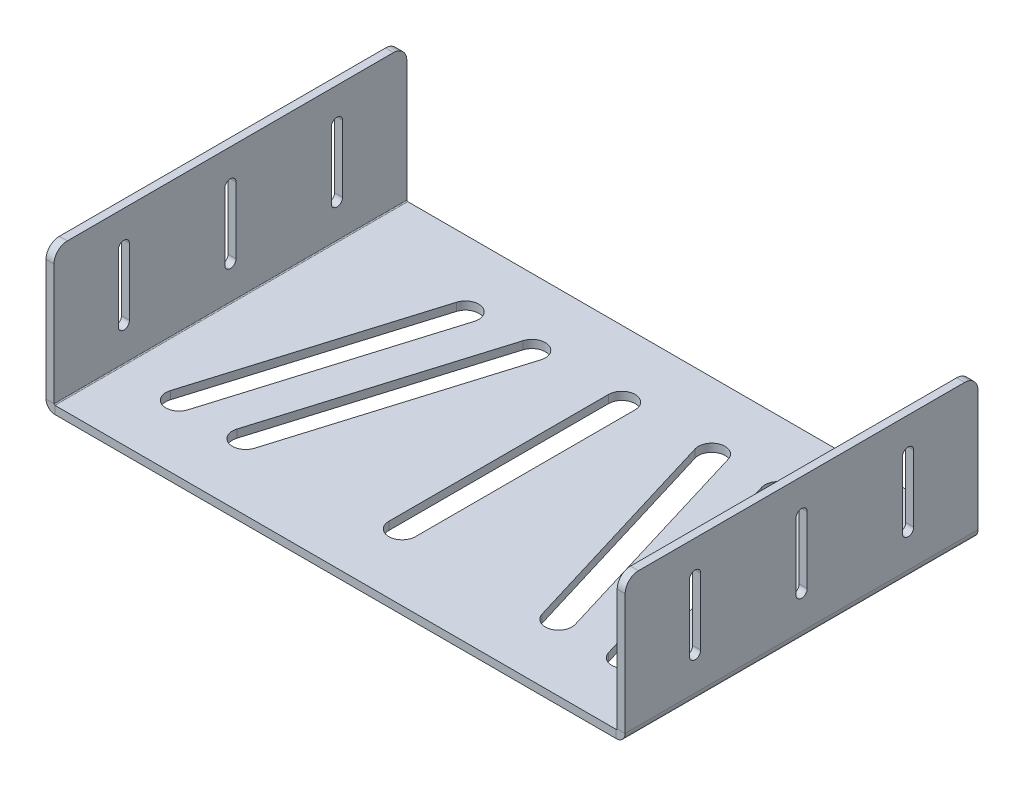
from build123d import *

# Parameters (mm, degrees)
BASE_FLANGE1_DEPTH         = 6
SKETCHED_START             = -317.5
SKETCHED_BEND1_OUTLINE_W   = 6
SKETCHED_BEND1_OUTLINE_H   = 265
SKETCHED_BEND1_DEPTH       = 100
SKETCHED_START_2           = 217.5
SKETCHED_BEND1_2_OUTLINE_W = 6
SKETCHED_BEND1_2_OUTLINE_H = 265
SKETCHED_BEND1_2_DEPTH     = 100
SKETCHED_START_3           = -216.844798284
SKETCHED_BEND1_3_DEPTH     = 5.344798284
SKETCHED_START_4           = 211.5
SKETCHED_BEND1_4_DEPTH     = 5.344798284
SKETCHED_START_5           = -217.5
SKETCHED_BEND1_5_DEPTH     = 6.7366
SKETCHED_START_6           = 210.7634
SKETCHED_BEND1_6_DEPTH     = 6.7366
SKETCHED_START_7           = -133
SKETCHED_BEND1_7_DEPTH     = 266


with BuildPart() as part:
    # Base-Flange1: sheet metal written as solids
    # Sketch1 → Base-Flange1 (new body)
    with BuildSketch(Plane(origin=(0, 0, 0), x_dir=(1, 0, 0), z_dir=(0, 1, 0))):
        with BuildLine():
            Line((-307.5, 132.5), (307.5, 132.5))
            ThreePointArc((307.5, 132.5), (314.571067812, 129.571067812), (317.5, 122.5))
            Line((317.5, 122.5), (317.5, -122.5))
            ThreePointArc((317.5, -122.5), (314.571067812, -129.571067812), (307.5, -132.5))
            Line((307.5, -132.5), (-307.5, -132.5))
            ThreePointArc((-307.5, -132.5), (-314.571067812, -129.571067812), (-317.5, -122.5))
            Line((-317.5, -122.5), (-317.5, 122.5))
            ThreePointArc((-317.5, 122.5), (-314.571067812, 129.571067812), (-307.5, 132.5))
        make_face()
        with BuildLine():
            Line((-107.929755956, 79.599926047), (-157.929755956, -85.400073953))
            ThreePointArc((-157.929755956, -85.400073953), (-170.400073953, -92.070244044), (-177.070244044, -79.599926047))
            Line((-177.070244044, -79.599926047), (-127.070244044, 85.400073953))
            ThreePointArc((-127.070244044, 85.400073953), (-114.599926047, 92.070244044), (-107.929755956, 79.599926047))
        make_face(mode=Mode.SUBTRACT)
        with BuildLine():
            Line((-57.929755956, 79.599926047), (-107.929755956, -85.400073953))
            ThreePointArc((-107.929755956, -85.400073953), (-120.400073953, -92.070244044), (-127.070244044, -79.599926047))
            Line((-127.070244044, -79.599926047), (-77.070244044, 85.400073953))
            ThreePointArc((-77.070244044, 85.400073953), (-64.599926047, 92.070244044), (-57.929755956, 79.599926047))
        make_face(mode=Mode.SUBTRACT)
        with BuildLine():
            Line((77.070244044, 85.400073953), (127.070244044, -79.599926047))
            ThreePointArc((127.070244044, -79.599926047), (120.400073953, -92.070244044), (107.929755956, -85.400073953))
            Line((107.929755956, -85.400073953), (57.929755956, 79.599926047))
            ThreePointArc((57.929755956, 79.599926047), (64.599926047, 92.070244044), (77.070244044, 85.400073953))
        make_face(mode=Mode.SUBTRACT)
        with BuildLine():
            Line((127.070244044, 85.400073953), (177.070244044, -79.599926047))
            ThreePointArc((177.070244044, -79.599926047), (170.400073953, -92.070244044), (157.929755956, -85.400073953))
            Line((157.929755956, -85.400073953), (107.929755956, 79.599926047))
            ThreePointArc((107.929755956, 79.599926047), (114.599926047, 92.070244044), (127.070244044, 85.400073953))
        make_face(mode=Mode.SUBTRACT)
        with BuildLine():
            Line((-292.5, 84.2), (-242.5, 84.2))
            ThreePointArc((-242.5, 84.2), (-238.3, 80), (-242.5, 75.8))
            Line((-242.5, 75.8), (-292.5, 75.8))
            ThreePointArc((-292.5, 75.8), (-296.7, 80), (-292.5, 84.2))
        make_face(mode=Mode.SUBTRACT)
        with BuildLine():
            Line((-292.5, 4.2), (-242.5, 4.2))
            ThreePointArc((-242.5, 4.2), (-238.3, 0), (-242.5, -4.2))
            Line((-242.5, -4.2), (-292.5, -4.2))
            ThreePointArc((-292.5, -4.2), (-296.7, 0), (-292.5, 4.2))
        make_face(mode=Mode.SUBTRACT)
        with BuildLine():
            Line((-292.5, -75.8), (-242.5, -75.8))
            ThreePointArc((-242.5, -75.8), (-238.3, -80), (-242.5, -84.2))
            Line((-242.5, -84.2), (-292.5, -84.2))
            ThreePointArc((-292.5, -84.2), (-296.7, -80), (-292.5, -75.8))
        make_face(mode=Mode.SUBTRACT)
        with BuildLine():
            Line((242.5, 84.2), (292.5, 84.2))
            ThreePointArc((292.5, 84.2), (296.7, 80), (292.5, 75.8))
            Line((292.5, 75.8), (242.5, 75.8))
            ThreePointArc((242.5, 75.8), (238.3, 80), (242.5, 84.2))
        make_face(mode=Mode.SUBTRACT)
        with BuildLine():
            Line((242.5, 4.2), (292.5, 4.2))
            ThreePointArc((292.5, 4.2), (296.7, 0), (292.5, -4.2))
            Line((292.5, -4.2), (242.5, -4.2))
            ThreePointArc((242.5, -4.2), (238.3, 0), (242.5, 4.2))
        make_face(mode=Mode.SUBTRACT)
        with BuildLine():
            Line((242.5, -75.8), (292.5, -75.8))
            ThreePointArc((292.5, -75.8), (296.7, -80), (292.5, -84.2))
            Line((292.5, -84.2), (242.5, -84.2))
            ThreePointArc((242.5, -84.2), (238.3, -80), (242.5, -75.8))
        make_face(mode=Mode.SUBTRACT)
        with BuildLine():
            Line((10, 82.5), (10, -82.5))
            ThreePointArc((10, -82.5), (0, -92.5), (-10, -82.5))
            Line((-10, -82.5), (-10, 82.5))
            ThreePointArc((-10, 82.5), (0, 92.5), (10, 82.5))
        make_face(mode=Mode.SUBTRACT)
    extrude(amount=-BASE_FLANGE1_DEPTH)

    # Sketched Bend1: read off the stored shape, not the designer's step
    # Sketched Bend1 outline → Sketched Bend1 (cut)
    with BuildSketch(Plane.YZ.offset(SKETCHED_START)):
        with Locations((-3, 0)):
            Rectangle(SKETCHED_BEND1_OUTLINE_W, SKETCHED_BEND1_OUTLINE_H)
    extrude(amount=SKETCHED_BEND1_DEPTH, mode=Mode.SUBTRACT)

    # Sketched Bend1 2 outline → Sketched Bend1 2 (cut)
    with BuildSketch(Plane.YZ.offset(SKETCHED_START_2)):
        with Locations((-3, 0)):
            Rectangle(SKETCHED_BEND1_2_OUTLINE_W, SKETCHED_BEND1_2_OUTLINE_H)
    extrude(amount=SKETCHED_BEND1_2_DEPTH, mode=Mode.SUBTRACT)

    # Sketched Bend1 3 outline → Sketched Bend1 3 (add)
    with BuildSketch(Plane.YZ.offset(SKETCHED_START_3)):
        with BuildLine():
            Line((0, 132.5), (0, -132.5))
            Line((0, -132.5), (91.603762445, -132.5))
            ThreePointArc((91.603762445, -132.5), (98.674830257, -129.571067812), (101.603762445, -122.5))
            Line((101.603762445, -122.5), (101.603762445, 122.5))
            ThreePointArc((101.603762445, 122.5), (98.674830257, 129.571067812), (91.603762445, 132.5))
            Line((91.603762445, 132.5), (0, 132.5))
        make_face()
        with BuildLine():
            ThreePointArc((26.603762445, -84.2), (22.403762445, -80), (26.603762445, -75.8))
            Line((26.603762445, -75.8), (76.603762445, -75.8))
            ThreePointArc((76.603762445, -75.8), (80.803762445, -80), (76.603762445, -84.2))
            Line((76.603762445, -84.2), (26.603762445, -84.2))
        make_face(mode=Mode.SUBTRACT)
        with BuildLine():
            ThreePointArc((26.603762445, -4.2), (22.403762445, 0), (26.603762445, 4.2))
            Line((26.603762445, 4.2), (76.603762445, 4.2))
            ThreePointArc((76.603762445, 4.2), (80.803762445, 0), (76.603762445, -4.2))
            Line((76.603762445, -4.2), (26.603762445, -4.2))
        make_face(mode=Mode.SUBTRACT)
        with BuildLine():
            ThreePointArc((26.603762445, 75.8), (22.403762445, 80), (26.603762445, 84.2))
            Line((26.603762445, 84.2), (76.603762445, 84.2))
            ThreePointArc((76.603762445, 84.2), (80.803762445, 80), (76.603762445, 75.8))
            Line((76.603762445, 75.8), (26.603762445, 75.8))
        make_face(mode=Mode.SUBTRACT)
    extrude(amount=SKETCHED_BEND1_3_DEPTH)

    # Sketched Bend1 4 outline → Sketched Bend1 4 (add)
    with BuildSketch(Plane.YZ.offset(SKETCHED_START_4)):
        with BuildLine():
            Line((0, 132.5), (0, -132.5))
            Line((0, -132.5), (91.603762445, -132.5))
            ThreePointArc((91.603762445, -132.5), (98.674830257, -129.571067812), (101.603762445, -122.5))
            Line((101.603762445, -122.5), (101.603762445, 122.5))
            ThreePointArc((101.603762445, 122.5), (98.674830257, 129.571067812), (91.603762445, 132.5))
            Line((91.603762445, 132.5), (0, 132.5))
        make_face()
        with BuildLine():
            ThreePointArc((26.603762445, -84.2), (22.403762445, -80), (26.603762445, -75.8))
            Line((26.603762445, -75.8), (76.603762445, -75.8))
            ThreePointArc((76.603762445, -75.8), (80.803762445, -80), (76.603762445, -84.2))
            Line((76.603762445, -84.2), (26.603762445, -84.2))
        make_face(mode=Mode.SUBTRACT)
        with BuildLine():
            ThreePointArc((26.603762445, -4.2), (22.403762445, 0), (26.603762445, 4.2))
            Line((26.603762445, 4.2), (76.603762445, 4.2))
            ThreePointArc((76.603762445, 4.2), (80.803762445, 0), (76.603762445, -4.2))
            Line((76.603762445, -4.2), (26.603762445, -4.2))
        make_face(mode=Mode.SUBTRACT)
        with BuildLine():
            ThreePointArc((26.603762445, 75.8), (22.403762445, 80), (26.603762445, 84.2))
            Line((26.603762445, 84.2), (76.603762445, 84.2))
            ThreePointArc((76.603762445, 84.2), (80.803762445, 80), (76.603762445, 75.8))
            Line((76.603762445, 75.8), (26.603762445, 75.8))
        make_face(mode=Mode.SUBTRACT)
    extrude(amount=SKETCHED_BEND1_4_DEPTH)

    # Sketched Bend1 5 outline → Sketched Bend1 5 (add)
    with BuildSketch(Plane.YZ.offset(SKETCHED_START_5)):
        with BuildLine():
            Line((0, 132.5), (0, -132.5))
            Line((0, -132.5), (91.603762445, -132.5))
            ThreePointArc((91.603762445, -132.5), (98.674830257, -129.571067812), (101.603762445, -122.5))
            Line((101.603762445, -122.5), (101.603762445, 122.5))
            ThreePointArc((101.603762445, 122.5), (98.674830257, 129.571067812), (91.603762445, 132.5))
            Line((91.603762445, 132.5), (0, 132.5))
        make_face()
        with BuildLine():
            ThreePointArc((26.603762445, -84.2), (22.403762445, -80), (26.603762445, -75.8))
            Line((26.603762445, -75.8), (76.603762445, -75.8))
            ThreePointArc((76.603762445, -75.8), (80.803762445, -80), (76.603762445, -84.2))
            Line((76.603762445, -84.2), (26.603762445, -84.2))
        make_face(mode=Mode.SUBTRACT)
        with BuildLine():
            ThreePointArc((26.603762445, -4.2), (22.403762445, 0), (26.603762445, 4.2))
            Line((26.603762445, 4.2), (76.603762445, 4.2))
            ThreePointArc((76.603762445, 4.2), (80.803762445, 0), (76.603762445, -4.2))
            Line((76.603762445, -4.2), (26.603762445, -4.2))
        make_face(mode=Mode.SUBTRACT)
        with BuildLine():
            ThreePointArc((26.603762445, 75.8), (22.403762445, 80), (26.603762445, 84.2))
            Line((26.603762445, 84.2), (76.603762445, 84.2))
            ThreePointArc((76.603762445, 84.2), (80.803762445, 80), (76.603762445, 75.8))
            Line((76.603762445, 75.8), (26.603762445, 75.8))
        make_face(mode=Mode.SUBTRACT)
    extrude(amount=SKETCHED_BEND1_5_DEPTH)

    # Sketched Bend1 6 outline → Sketched Bend1 6 (add)
    with BuildSketch(Plane.YZ.offset(SKETCHED_START_6)):
        with BuildLine():
            Line((0, 132.5), (0, -132.5))
            Line((0, -132.5), (91.603762445, -132.5))
            ThreePointArc((91.603762445, -132.5), (98.674830257, -129.571067812), (101.603762445, -122.5))
            Line((101.603762445, -122.5), (101.603762445, 122.5))
            ThreePointArc((101.603762445, 122.5), (98.674830257, 129.571067812), (91.603762445, 132.5))
            Line((91.603762445, 132.5), (0, 132.5))
        make_face()
        with BuildLine():
            ThreePointArc((26.603762445, -84.2), (22.403762445, -80), (26.603762445, -75.8))
            Line((26.603762445, -75.8), (76.603762445, -75.8))
            ThreePointArc((76.603762445, -75.8), (80.803762445, -80), (76.603762445, -84.2))
            Line((76.603762445, -84.2), (26.603762445, -84.2))
        make_face(mode=Mode.SUBTRACT)
        with BuildLine():
            ThreePointArc((26.603762445, -4.2), (22.403762445, 0), (26.603762445, 4.2))
            Line((26.603762445, 4.2), (76.603762445, 4.2))
            ThreePointArc((76.603762445, 4.2), (80.803762445, 0), (76.603762445, -4.2))
            Line((76.603762445, -4.2), (26.603762445, -4.2))
        make_face(mode=Mode.SUBTRACT)
        with BuildLine():
            ThreePointArc((26.603762445, 75.8), (22.403762445, 80), (26.603762445, 84.2))
            Line((26.603762445, 84.2), (76.603762445, 84.2))
            ThreePointArc((76.603762445, 84.2), (80.803762445, 80), (76.603762445, 75.8))
            Line((76.603762445, 75.8), (26.603762445, 75.8))
        make_face(mode=Mode.SUBTRACT)
    extrude(amount=SKETCHED_BEND1_6_DEPTH)

    # Sketched Bend1 7 outline → Sketched Bend1 7 (cut)
    with BuildSketch(Plane.XY.offset(SKETCHED_START_7)):
        with BuildLine():
            Line((-217.5, -6), (-210.7634, -6))
            ThreePointArc((-210.7634, -6), (-215.526895542, -4.026895542), (-217.5, 0.7366))
            Line((-217.5, 0.7366), (-217.5, -6))
        make_face()
        with BuildLine():
            Line((211.5, 0.7366), (211.5, 101.603762445))
            Line((211.5, 101.603762445), (210.7634, 101.603762445))
            Line((210.7634, 101.603762445), (210.7634, 0))
            ThreePointArc((210.7634, 0), (211.284254855, 0.215745145), (211.5, 0.7366))
        make_face()
        with BuildLine():
            ThreePointArc((217.5, 0.7366), (215.526895542, -4.026895542), (210.7634, -6))
            Line((210.7634, -6), (217.5, -6))
            Line((217.5, -6), (217.5, 0.7366))
        make_face()
        with BuildLine():
            Line((-210.7634, 101.603762445), (-211.5, 101.603762445))
            Line((-211.5, 101.603762445), (-211.5, 0.7366))
            ThreePointArc((-211.5, 0.7366), (-211.284254855, 0.215745145), (-210.7634, 0))
            Line((-210.7634, 0), (-210.7634, 101.603762445))
        make_face()
    extrude(amount=SKETCHED_BEND1_7_DEPTH, mode=Mode.SUBTRACT)


solid = part.part
